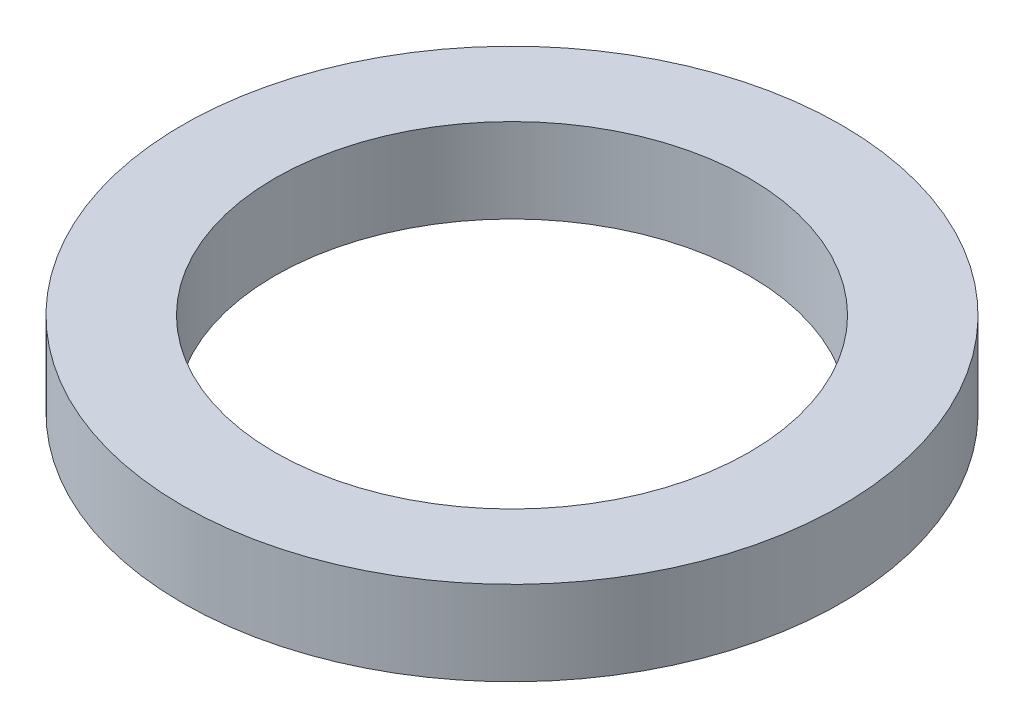
from build123d import *

# Parameters (mm, degrees)
SKETCH1_R           = 62.5
BOSS_EXTRUDE1_DEPTH = 16
SKETCH2_R           = 45
CUT_EXTRUDE1_DEPTH  = 90.824829529


with BuildPart() as part:
    # Sketch1 → Boss-Extrude1 (new body)
    with BuildSketch(Plane(origin=(0, 0, 0), x_dir=(1, 0, 0), z_dir=(0, 1, 0))):
        Circle(SKETCH1_R)
    extrude(amount=BOSS_EXTRUDE1_DEPTH)

    # Sketch2 → Cut-Extrude1 (cut, through all)
    with BuildSketch(Plane(origin=(0, 0, 0), x_dir=(1, 0, 0), z_dir=(0, 1, 0))):
        Circle(SKETCH2_R)
    extrude(amount=CUT_EXTRUDE1_DEPTH, mode=Mode.SUBTRACT)


solid = part.part
